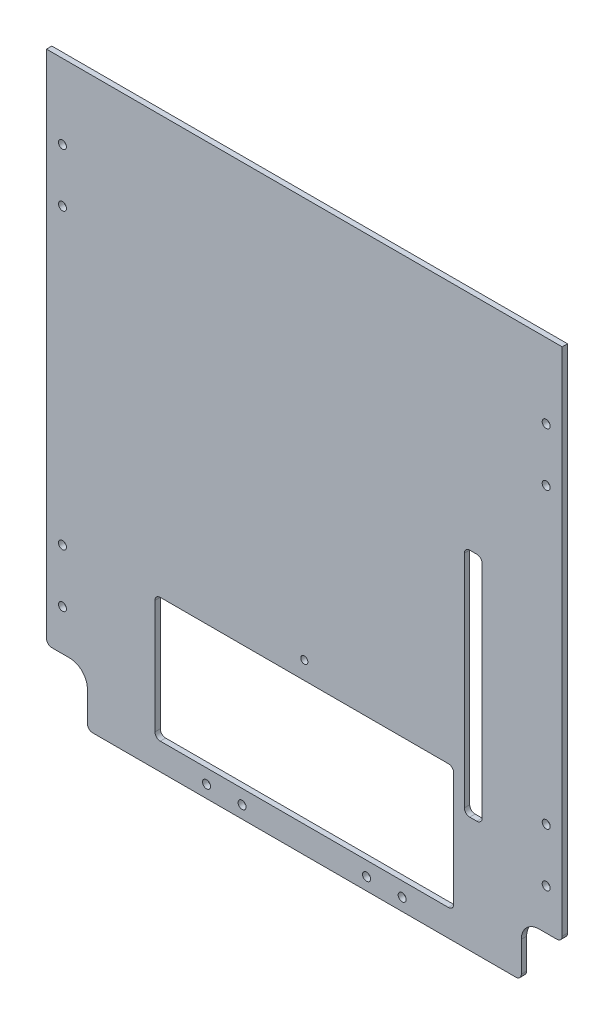
from build123d import *

# Parameters (mm, degrees)
ESQUISSE1_W                  = 290
ESQUISSE1_H                  = 320
BOSS_EXTRU_1_DEPTH           = 3
ENL_V_MAT_EXTRU_1_DEPTH      = 432.866877637
ENL_V_MAT_EXTRU_1_DEPTH_BACK = 432.866877637
ESQUISSE2_W                  = 23
ESQUISSE2_H                  = 30
CONG_1_R                     = 10
CONG_2_R                     = 3
ENL_V_MAT_EXTRU_2_DEPTH      = 432.866877637
ENL_V_MAT_EXTRU_2_DEPTH_BACK = 432.866877637
ESQUISSE3_W                  = 10
ESQUISSE3_H                  = 130
ENL_V_MAT_EXTRU_3_DEPTH      = 432.866877637
ENL_V_MAT_EXTRU_3_DEPTH_BACK = 432.866877637
ESQUISSE4_W                  = 168
ESQUISSE4_H                  = 70
CONG_3_R                     = 3
ENL_V_MAT_EXTRU_4_DEPTH      = 432.866877637
ENL_V_MAT_EXTRU_4_DEPTH_BACK = 432.866877637
ESQUISSE5_R                  = 2
ESQUISSE5_R_2                = 2.25
ENL_V_MAT_EXTRU_5_DEPTH      = 432.866877637
ENL_V_MAT_EXTRU_5_DEPTH_BACK = 432.866877637
ESQUISSE6_R                  = 2.25


with BuildPart() as part:
    # Esquisse1 → Boss.-Extru.1 (new body)
    with BuildSketch(Plane.XY):
        with Locations((145, 160)):
            Rectangle(ESQUISSE1_W, ESQUISSE1_H)
    extrude(amount=BOSS_EXTRU_1_DEPTH)

    # Esquisse2 → Enlèv. mat.-Extru.1 (cut, two sides: drawn at the far end of the back side and taken through both)
    with BuildSketch(Plane.XY.offset(3).offset(-ENL_V_MAT_EXTRU_1_DEPTH_BACK)):
        with Locations((278.5, 15)):
            Rectangle(ESQUISSE2_W, ESQUISSE2_H)
        with Locations((11.5, 15)):
            Rectangle(ESQUISSE2_W, ESQUISSE2_H)
    extrude(amount=ENL_V_MAT_EXTRU_1_DEPTH + ENL_V_MAT_EXTRU_1_DEPTH_BACK, mode=Mode.SUBTRACT)

    # Congé1
    cong_1_edges = [part.edges().sort_by_distance(p)[0] for p in [
        (23, 30, 1.5),
        (267, 30, 1.5),
    ]]
    fillet(cong_1_edges, radius=CONG_1_R)

    # Congé2
    cong_2_edges = [part.edges().sort_by_distance(p)[0] for p in [
        (267, 0, 1.5),
        (290, 30, 1.5),
        (23, 0, 1.5),
        (0, 30, 1.5),
    ]]
    fillet(cong_2_edges, radius=CONG_2_R)

    # Esquisse3 → Enlèv. mat.-Extru.2 (cut, two sides: drawn at the far end of the back side and taken through both)
    with BuildSketch(Plane.XY.offset(3).offset(-ENL_V_MAT_EXTRU_2_DEPTH_BACK)):
        with Locations((240, 130)):
            Rectangle(ESQUISSE3_W, ESQUISSE3_H)
    extrude(amount=ENL_V_MAT_EXTRU_2_DEPTH + ENL_V_MAT_EXTRU_2_DEPTH_BACK, mode=Mode.SUBTRACT)

    # Esquisse4 → Enlèv. mat.-Extru.3 (cut, two sides: drawn at the far end of the back side and taken through both)
    with BuildSketch(Plane.XY.offset(3).offset(-ENL_V_MAT_EXTRU_3_DEPTH_BACK)):
        with Locations((145, 50)):
            Rectangle(ESQUISSE4_W, ESQUISSE4_H)
    extrude(amount=ENL_V_MAT_EXTRU_3_DEPTH + ENL_V_MAT_EXTRU_3_DEPTH_BACK, mode=Mode.SUBTRACT)

    # Congé3
    cong_3_edges = [part.edges().sort_by_distance(p)[0] for p in [
        (235, 195, 1.5),
        (245, 195, 1.5),
        (245, 65, 1.5),
        (235, 65, 1.5),
        (229, 15, 1.5),
        (229, 85, 1.5),
        (61, 85, 1.5),
        (61, 15, 1.5),
    ]]
    fillet(cong_3_edges, radius=CONG_3_R)

    # Esquisse5 → Enlèv. mat.-Extru.4 (cut, two sides: drawn at the far end of the back side and taken through both)
    with BuildSketch(Plane.XY.offset(3).offset(-ENL_V_MAT_EXTRU_4_DEPTH_BACK)):
        with Locations((145, 95)):
            Circle(ESQUISSE5_R)
        with Locations((90, 7)):
            Circle(ESQUISSE5_R_2)
        with Locations((110, 7)):
            Circle(ESQUISSE5_R_2)
        with Locations((180, 7)):
            Circle(ESQUISSE5_R_2)
        with Locations((200, 7)):
            Circle(ESQUISSE5_R_2)
    extrude(amount=ENL_V_MAT_EXTRU_4_DEPTH + ENL_V_MAT_EXTRU_4_DEPTH_BACK, mode=Mode.SUBTRACT)

    # Esquisse6 → Enlèv. mat.-Extru.5 (cut, two sides: drawn at the far end of the back side and taken through both)
    with BuildSketch(Plane.XY.offset(3).offset(-ENL_V_MAT_EXTRU_5_DEPTH_BACK)):
        with Locations((281, 83)):
            Circle(ESQUISSE6_R)
        with Locations((281, 53)):
            Circle(ESQUISSE6_R)
        with Locations((281, 278)):
            Circle(ESQUISSE6_R)
        with Locations((281, 248)):
            Circle(ESQUISSE6_R)
        with Locations((9, 248)):
            Circle(ESQUISSE6_R)
        with Locations((9, 278)):
            Circle(ESQUISSE6_R)
        with Locations((9, 53)):
            Circle(ESQUISSE6_R)
        with Locations((9, 83)):
            Circle(ESQUISSE6_R)
    extrude(amount=ENL_V_MAT_EXTRU_5_DEPTH + ENL_V_MAT_EXTRU_5_DEPTH_BACK, mode=Mode.SUBTRACT)


solid = part.part
